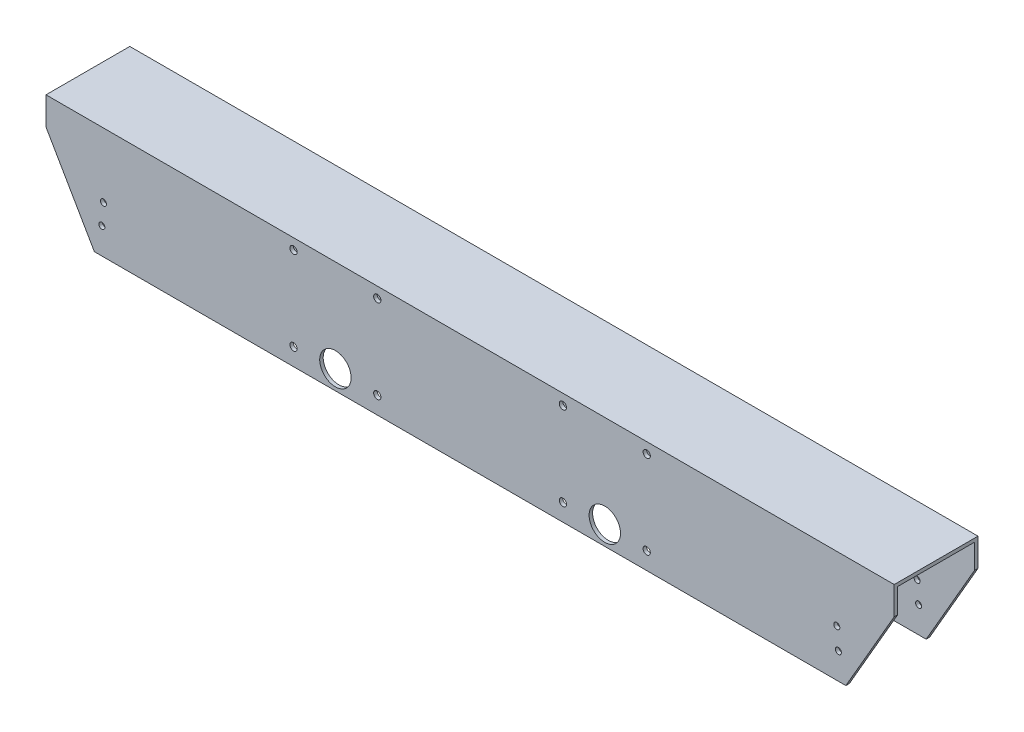
from build123d import *

# Parameters (mm, degrees)
BOSS_EXTRUDE1_DEPTH = 385.705756272
SKETCH2_R           = 2.749999961
SKETCH2_R_2         = 14.2875
SKETCH2_R_3         = 2.75
CUT_EXTRUDE1_DEPTH  = 141.732
SKETCH14_R          = 3.302
CUT_EXTRUDE12_DEPTH = 397.429073633
CUT_EXTRUDE13_DEPTH = 101.6


with BuildPart() as part:
    # Sketch1 → Boss-Extrude1 (new, symmetric)
    with BuildSketch(Plane(origin=(0, 0, 0), x_dir=(0, 0, -1), z_dir=(1, 0, 0))):
        Polygon((-38.1, 50.8), (38.1, 50.8), (38.1, -50.8), (34.925, -50.8), (34.925, 47.625), (-34.925, 47.625), (-34.925, -50.8), (-38.1, -50.8), align=None)
    extrude(amount=BOSS_EXTRUDE1_DEPTH, both=True)

    # Sketch2 → Cut-Extrude1 (cut)
    with BuildSketch(Plane.XY.offset(38.1)):
        with Locations((-333.475837626, -7.9375)):
            Circle(SKETCH2_R)
        with Locations((122.50039, -33.3375)):
            Circle(SKETCH2_R_2)
        with Locations((333.475837626, -7.9375)):
            Circle(SKETCH2_R)
        with Locations((334.902632555, -26.927596819)):
            Circle(SKETCH2_R_3)
        with Locations((-122.50039, -33.3375)):
            Circle(SKETCH2_R_2)
        with Locations((-334.902632555, -26.927596819)):
            Circle(SKETCH2_R_3)
    extrude(amount=-CUT_EXTRUDE1_DEPTH, mode=Mode.SUBTRACT)

    # Sketch14 → Cut-Extrude12 (cut, through all)
    with BuildSketch(Plane(origin=(0, 0, -38.1), x_dir=(-1, 0, 0), z_dir=(0, 0, -1))):
        with Locations((-160.60039, -35.123476108)):
            Circle(SKETCH14_R)
        with Locations((-160.61182, 41.076523035)):
            Circle(SKETCH14_R)
        with Locations((-84.41182, 41.076523892)):
            Circle(SKETCH14_R)
        with Locations((-84.41182, -35.123476108)):
            Circle(SKETCH14_R)
        with Locations((160.60039, -35.123476108)):
            Circle(SKETCH14_R)
        with Locations((84.41182, -35.123476108)):
            Circle(SKETCH14_R)
        with Locations((84.41182, 41.076523892)):
            Circle(SKETCH14_R)
        with Locations((160.61182, 41.076523035)):
            Circle(SKETCH14_R)
    extrude(amount=-CUT_EXTRUDE12_DEPTH, mode=Mode.SUBTRACT)

    # Sketch16 → Cut-Extrude13 (cut)
    with BuildSketch(Plane.XY.offset(38.1)):
        Polygon((-385.705756272, 25.4), (-341.71166576, -50.8), (-385.705756272, -50.8), align=None)
        Polygon((341.71166576, -50.8), (385.705756272, -50.8), (385.705756272, 25.4), align=None)
    extrude(amount=-CUT_EXTRUDE13_DEPTH, mode=Mode.SUBTRACT)


solid = part.part
